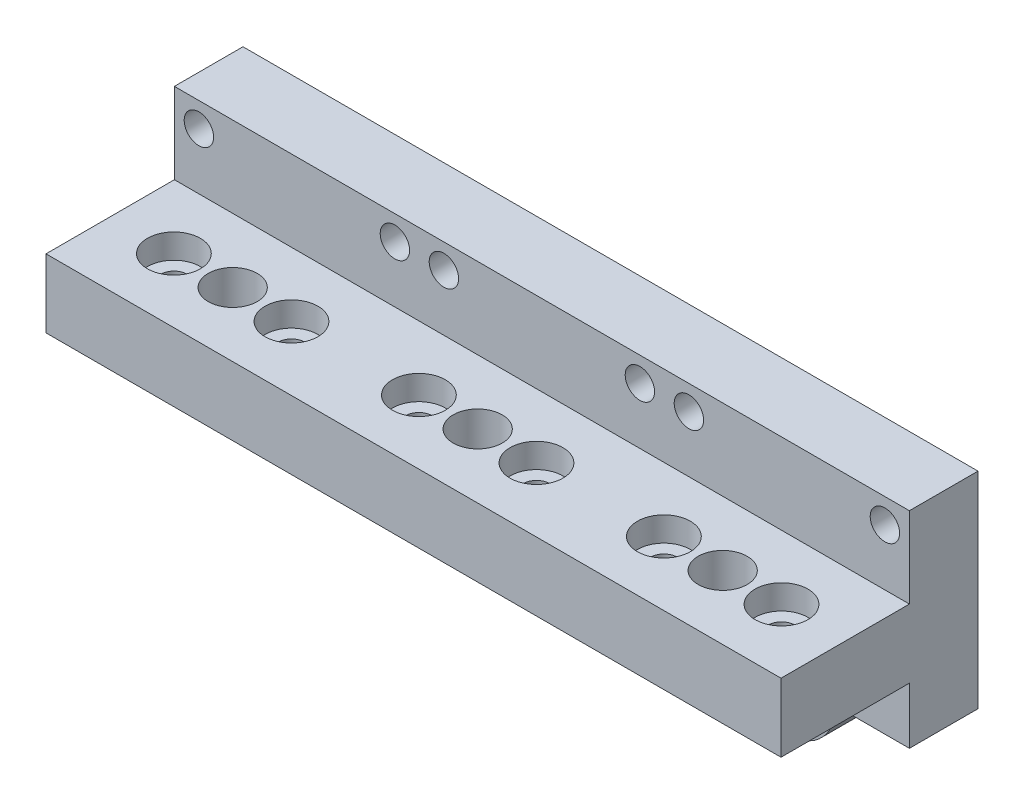
from build123d import *

# Parameters (mm, degrees)
SKETCH1_R           = 1.79994
SKETCH1_R_2         = 1.5
BOSS_EXTRUDE1_DEPTH = 7
SKETCH2_W           = 75
SKETCH2_H           = 13.099999962
SKETCH2_R           = 2.499995
SKETCH2_R_2         = 1.3498449
BOSS_EXTRUDE2_DEPTH = 6.987999994
SKETCH2_3_R         = 2.6999438
SKETCH2_3_R_2       = 1.3498449
CUT_EXTRUDE1_DEPTH  = 2.5


with BuildPart() as part:
    # Sketch1 → Boss-Extrude1 (new body)
    with BuildSketch(Plane.XY):
        with BuildLine():
            Line((37.5, -10.5), (30, -10.5))
            ThreePointArc((30, -10.5), (25, -15.5), (20, -10.5))
            Line((20, -10.5), (5, -10.5))
            ThreePointArc((5, -10.5), (0, -15.5), (-5, -10.5))
            Line((-5, -10.5), (-20, -10.5))
            ThreePointArc((-20, -10.5), (-25, -15.5), (-30, -10.5))
            Line((-30, -10.5), (-37.5, -10.5))
            Line((-37.5, -10.5), (-37.5, 10.5))
            Line((-37.5, 10.5), (37.5, 10.5))
            Line((37.5, 10.5), (37.5, -10.5))
        make_face()
        with Locations((-25, -10.5)):
            Circle(SKETCH1_R, mode=Mode.SUBTRACT)
        with Locations((0, -10.5)):
            Circle(SKETCH1_R, mode=Mode.SUBTRACT)
        with Locations((25, -10.5)):
            Circle(SKETCH1_R, mode=Mode.SUBTRACT)
        with Locations((-35, 8)):
            Circle(SKETCH1_R_2, mode=Mode.SUBTRACT)
        with Locations((-15, 8)):
            Circle(SKETCH1_R_2, mode=Mode.SUBTRACT)
        with Locations((-10, 8)):
            Circle(SKETCH1_R_2, mode=Mode.SUBTRACT)
        with Locations((10, 8)):
            Circle(SKETCH1_R_2, mode=Mode.SUBTRACT)
        with Locations((35, 8)):
            Circle(SKETCH1_R_2, mode=Mode.SUBTRACT)
        with Locations((15, 8)):
            Circle(SKETCH1_R_2, mode=Mode.SUBTRACT)
    extrude(amount=BOSS_EXTRUDE1_DEPTH)

    # Sketch2 → Boss-Extrude2 (add)
    with BuildSketch(Plane(origin=(0, 2.24999999, 0), x_dir=(1, 0, 0), z_dir=(0, 1, 0))):
        with Locations((0, -13.549999981)):
            Rectangle(SKETCH2_W, SKETCH2_H)
        with Locations((-25, -13.549999981)):
            Circle(SKETCH2_R, mode=Mode.SUBTRACT)
        with Locations((0, -13.549999981)):
            Circle(SKETCH2_R, mode=Mode.SUBTRACT)
        with Locations((25, -13.549999981)):
            Circle(SKETCH2_R, mode=Mode.SUBTRACT)
        with Locations((-31.0001404, -13.549999981)):
            Circle(SKETCH2_R_2, mode=Mode.SUBTRACT)
        with Locations((-18.9998596, -13.549999981)):
            Circle(SKETCH2_R_2, mode=Mode.SUBTRACT)
        with Locations((-6.0001404, -13.549999981)):
            Circle(SKETCH2_R_2, mode=Mode.SUBTRACT)
        with Locations((6.0001404, -13.549999981)):
            Circle(SKETCH2_R_2, mode=Mode.SUBTRACT)
        with Locations((18.9998596, -13.549999981)):
            Circle(SKETCH2_R_2, mode=Mode.SUBTRACT)
        with Locations((31.0001404, -13.549999981)):
            Circle(SKETCH2_R_2, mode=Mode.SUBTRACT)
    extrude(amount=-BOSS_EXTRUDE2_DEPTH)

    # Sketch2<3> → Cut-Extrude1 (cut)
    # profile 1 of 6: a face of its own
    with BuildSketch(Plane(origin=(0, 2.24999999, 0), x_dir=(1, 0, 0), z_dir=(0, 1, 0))):
        with Locations((6.0001404, -13.549999981)):
            Circle(SKETCH2_3_R)
        with Locations((6.0001404, -13.549999981)):
            Circle(SKETCH2_3_R_2, mode=Mode.SUBTRACT)
    # profile 2 of 6: a face of its own
    with BuildSketch(Plane(origin=(0, 2.24999999, 0), x_dir=(1, 0, 0), z_dir=(0, 1, 0))):
        with Locations((-6.0001404, -13.549999981)):
            Circle(SKETCH2_3_R)
        with Locations((-6.0001404, -13.549999981)):
            Circle(SKETCH2_3_R_2, mode=Mode.SUBTRACT)
    # profile 3 of 6: a face of its own
    with BuildSketch(Plane(origin=(0, 2.24999999, 0), x_dir=(1, 0, 0), z_dir=(0, 1, 0))):
        with Locations((-18.9998596, -13.549999981)):
            Circle(SKETCH2_3_R)
        with Locations((-18.9998596, -13.549999981)):
            Circle(SKETCH2_3_R_2, mode=Mode.SUBTRACT)
    # profile 4 of 6: a face of its own
    with BuildSketch(Plane(origin=(0, 2.24999999, 0), x_dir=(1, 0, 0), z_dir=(0, 1, 0))):
        with Locations((-31.0001404, -13.549999981)):
            Circle(SKETCH2_3_R)
        with Locations((-31.0001404, -13.549999981)):
            Circle(SKETCH2_3_R_2, mode=Mode.SUBTRACT)
    # profile 5 of 6: a face of its own
    with BuildSketch(Plane(origin=(0, 2.24999999, 0), x_dir=(1, 0, 0), z_dir=(0, 1, 0))):
        with Locations((31.0001404, -13.549999981)):
            Circle(SKETCH2_3_R)
        with Locations((31.0001404, -13.549999981)):
            Circle(SKETCH2_3_R_2, mode=Mode.SUBTRACT)
    # profile 6 of 6: a face of its own
    with BuildSketch(Plane(origin=(0, 2.24999999, 0), x_dir=(1, 0, 0), z_dir=(0, 1, 0))):
        with Locations((18.9998596, -13.549999981)):
            Circle(SKETCH2_3_R)
        with Locations((18.9998596, -13.549999981)):
            Circle(SKETCH2_3_R_2, mode=Mode.SUBTRACT)
    extrude(amount=-CUT_EXTRUDE1_DEPTH, mode=Mode.SUBTRACT)


solid = part.part
